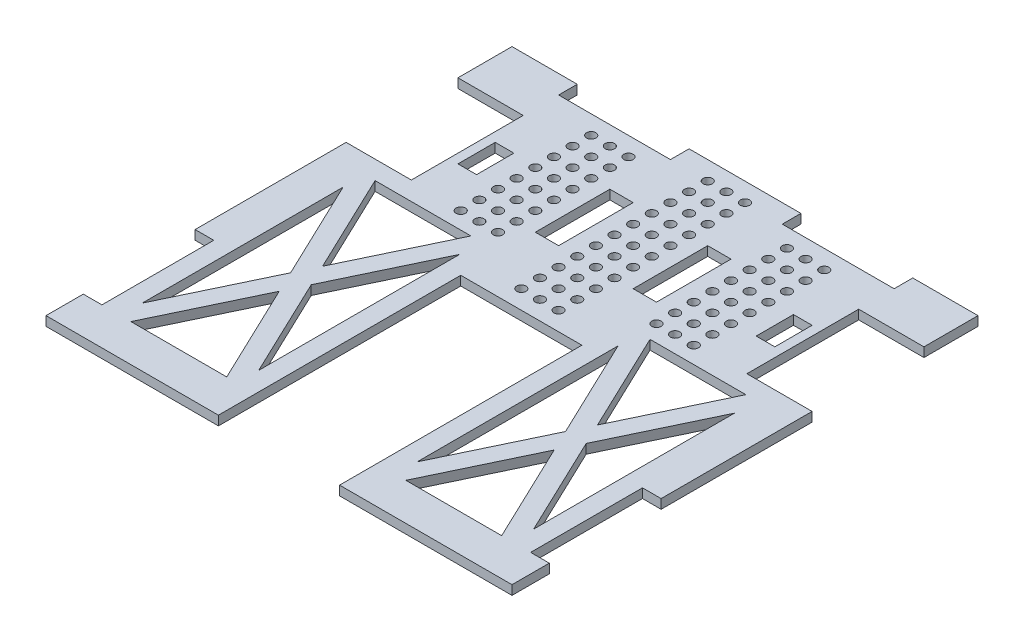
from build123d import *

# Parameters (mm, degrees)
BOSS_EXTRUDE1_DEPTH = 6.35
SKETCH2_W           = 44.45
SKETCH2_H           = 76.2
SKETCH2_W_2         = 12.7
SKETCH2_W_3         = 76.2
SKETCH2_H_2         = 12.7
CUT_EXTRUDE1_DEPTH  = 289.907554418
CUT_EXTRUDE3_DEPTH  = 289.907554418
SKETCH3_W           = 15.875
SKETCH3_H           = 50.8
SKETCH3_W_2         = 12.7
SKETCH3_H_2         = 25.4
CUT_EXTRUDE2_DEPTH  = 289.907554418
SKETCH5_R           = 3.175
CUT_EXTRUDE4_DEPTH  = 289.907554418


with BuildPart() as part:
    # Sketch1 → Boss-Extrude1 (new body)
    with BuildSketch(Plane(origin=(0, 0, 0), x_dir=(1, 0, 0), z_dir=(0, 1, 0))):
        Polygon((-158.75, 76.2), (-158.75, -241.3), (-41.275, -241.3), (-41.275, -76.2), (41.275, -76.2), (41.275, -241.3), (158.75, -241.3), (158.75, 76.2), align=None)
    extrude(amount=BOSS_EXTRUDE1_DEPTH)

    # Sketch2 → Cut-Extrude1 (cut, through all)
    with BuildSketch(Plane(origin=(0, 6.35, 0), x_dir=(1, 0, 0), z_dir=(0, 1, 0))):
        with Locations((136.525, 1.27)):
            Rectangle(SKETCH2_W, SKETCH2_H)
        with Locations((152.4, -177.8)):
            Rectangle(SKETCH2_W_2, SKETCH2_H)
        with Locations((-152.4, -177.8)):
            Rectangle(SKETCH2_W_2, SKETCH2_H)
        with Locations((-136.525, 1.27)):
            Rectangle(SKETCH2_W, SKETCH2_H)
        with Locations((-76.2, 69.85)):
            Rectangle(SKETCH2_W_3, SKETCH2_H_2)
        with Locations((76.2, 69.85)):
            Rectangle(SKETCH2_W_3, SKETCH2_H_2)
    extrude(amount=-CUT_EXTRUDE1_DEPTH, mode=Mode.SUBTRACT)

    # Sketch4 → Cut-Extrude3 (cut, through all)
    with BuildSketch(Plane(origin=(0, 6.35, 0), x_dir=(1, 0, 0), z_dir=(0, 1, 0))):
        Polygon((93.6625, -147.46179464), (61.010684466, -215.9), (126.314315534, -215.9), align=None)
        Polygon((53.975, -64.27679464), (53.975, -201.15320536), (86.626815534, -132.715), align=None)
        Polygon((133.35, -64.27679464), (100.698184466, -132.715), (133.35, -201.15320536), align=None)
        Polygon((61.010684466, -49.53), (93.6625, -117.96820536), (126.314315534, -49.53), align=None)
        Polygon((-86.626815534, -132.715), (-53.975, -201.15320536), (-53.975, -64.27679464), align=None)
        Polygon((-126.314315534, -49.53), (-93.6625, -117.96820536), (-61.010684466, -49.53), align=None)
        Polygon((-61.010684466, -215.9), (-93.6625, -147.46179464), (-126.314315534, -215.9), align=None)
        Polygon((-133.35, -201.15320536), (-100.698184466, -132.715), (-133.35, -64.27679464), align=None)
    extrude(amount=-CUT_EXTRUDE3_DEPTH, mode=Mode.SUBTRACT)

    # Sketch3 → Cut-Extrude2 (cut, through all)
    with BuildSketch(Plane(origin=(0, 6.35, 0), x_dir=(1, 0, 0), z_dir=(0, 1, 0))):
        with Locations((-33.3375, 0)):
            Rectangle(SKETCH3_W, SKETCH3_H)
        with Locations((33.3375, 0)):
            Rectangle(SKETCH3_W, SKETCH3_H)
        with Locations((101.6, 1.27)):
            Rectangle(SKETCH3_W_2, SKETCH3_H_2)
        with Locations((-101.6, 1.27)):
            Rectangle(SKETCH3_W_2, SKETCH3_H_2)
    extrude(amount=-CUT_EXTRUDE2_DEPTH, mode=Mode.SUBTRACT)

    # Sketch5 → Cut-Extrude4 (cut, through all)
    with BuildSketch(Plane(origin=(0, 6.35, 0), x_dir=(1, 0, 0), z_dir=(0, 1, 0))):
        with Locations((12.7, 63.5)):
            Circle(SKETCH5_R)
        with Locations((12.7, 50.8)):
            Circle(SKETCH5_R)
        with Locations((12.7, 38.1)):
            Circle(SKETCH5_R)
        with Locations((12.7, 25.4)):
            Circle(SKETCH5_R)
        with Locations((12.7, 12.7)):
            Circle(SKETCH5_R)
        with Locations((12.7, 0)):
            Circle(SKETCH5_R)
        with Locations((12.7, -12.7)):
            Circle(SKETCH5_R)
        with Locations((12.7, -25.4)):
            Circle(SKETCH5_R)
        with Locations((12.7, -38.1)):
            Circle(SKETCH5_R)
        with Locations((12.7, -50.8)):
            Circle(SKETCH5_R)
        with Locations((12.7, -63.5)):
            Circle(SKETCH5_R)
        with Locations((0, 50.8)):
            Circle(SKETCH5_R)
        with Locations((0, 38.1)):
            Circle(SKETCH5_R)
        with Locations((0, 25.4)):
            Circle(SKETCH5_R)
        with Locations((0, 12.7)):
            Circle(SKETCH5_R)
        Circle(SKETCH5_R)
        with Locations((0, -12.7)):
            Circle(SKETCH5_R)
        with Locations((0, -25.4)):
            Circle(SKETCH5_R)
        with Locations((0, -38.1)):
            Circle(SKETCH5_R)
        with Locations((0, -50.8)):
            Circle(SKETCH5_R)
        with Locations((0, -63.5)):
            Circle(SKETCH5_R)
        with Locations((-12.7, 50.8)):
            Circle(SKETCH5_R)
        with Locations((-12.7, 38.1)):
            Circle(SKETCH5_R)
        with Locations((-12.7, 25.4)):
            Circle(SKETCH5_R)
        with Locations((-12.7, 12.7)):
            Circle(SKETCH5_R)
        with Locations((-12.7, 0)):
            Circle(SKETCH5_R)
        with Locations((-12.7, -12.7)):
            Circle(SKETCH5_R)
        with Locations((-12.7, -25.4)):
            Circle(SKETCH5_R)
        with Locations((-12.7, -38.1)):
            Circle(SKETCH5_R)
        with Locations((-12.7, -50.8)):
            Circle(SKETCH5_R)
        with Locations((-12.7, -63.5)):
            Circle(SKETCH5_R)
        with Locations((0, 63.5)):
            Circle(SKETCH5_R)
        with Locations((-12.7, 63.5)):
            Circle(SKETCH5_R)
        with Locations((53.975, 50.8)):
            Circle(SKETCH5_R)
        with Locations((66.675, 50.8)):
            Circle(SKETCH5_R)
        with Locations((79.375, 50.8)):
            Circle(SKETCH5_R)
        with Locations((66.675, 38.1)):
            Circle(SKETCH5_R)
        with Locations((79.375, 38.1)):
            Circle(SKETCH5_R)
        with Locations((66.675, 25.4)):
            Circle(SKETCH5_R)
        with Locations((79.375, 25.4)):
            Circle(SKETCH5_R)
        with Locations((66.675, 12.7)):
            Circle(SKETCH5_R)
        with Locations((79.375, 12.7)):
            Circle(SKETCH5_R)
        with Locations((66.675, 0)):
            Circle(SKETCH5_R)
        with Locations((79.375, 0)):
            Circle(SKETCH5_R)
        with Locations((66.675, -12.7)):
            Circle(SKETCH5_R)
        with Locations((79.375, -12.7)):
            Circle(SKETCH5_R)
        with Locations((66.675, -25.4)):
            Circle(SKETCH5_R)
        with Locations((79.375, -25.4)):
            Circle(SKETCH5_R)
        with Locations((66.675, -38.1)):
            Circle(SKETCH5_R)
        with Locations((79.375, -38.1)):
            Circle(SKETCH5_R)
        with Locations((53.975, 38.1)):
            Circle(SKETCH5_R)
        with Locations((53.975, 25.4)):
            Circle(SKETCH5_R)
        with Locations((53.975, 12.7)):
            Circle(SKETCH5_R)
        with Locations((53.975, 0)):
            Circle(SKETCH5_R)
        with Locations((53.975, -12.7)):
            Circle(SKETCH5_R)
        with Locations((53.975, -25.4)):
            Circle(SKETCH5_R)
        with Locations((53.975, -38.1)):
            Circle(SKETCH5_R)
        with Locations((-53.975, -38.1)):
            Circle(SKETCH5_R)
        with Locations((-53.975, -25.4)):
            Circle(SKETCH5_R)
        with Locations((-53.975, -12.7)):
            Circle(SKETCH5_R)
        with Locations((-53.975, 0)):
            Circle(SKETCH5_R)
        with Locations((-53.975, 12.7)):
            Circle(SKETCH5_R)
        with Locations((-53.975, 25.4)):
            Circle(SKETCH5_R)
        with Locations((-53.975, 38.1)):
            Circle(SKETCH5_R)
        with Locations((-79.375, -38.1)):
            Circle(SKETCH5_R)
        with Locations((-66.675, -38.1)):
            Circle(SKETCH5_R)
        with Locations((-79.375, -25.4)):
            Circle(SKETCH5_R)
        with Locations((-66.675, -25.4)):
            Circle(SKETCH5_R)
        with Locations((-79.375, -12.7)):
            Circle(SKETCH5_R)
        with Locations((-66.675, -12.7)):
            Circle(SKETCH5_R)
        with Locations((-79.375, 0)):
            Circle(SKETCH5_R)
        with Locations((-66.675, 0)):
            Circle(SKETCH5_R)
        with Locations((-79.375, 12.7)):
            Circle(SKETCH5_R)
        with Locations((-66.675, 12.7)):
            Circle(SKETCH5_R)
        with Locations((-79.375, 25.4)):
            Circle(SKETCH5_R)
        with Locations((-66.675, 25.4)):
            Circle(SKETCH5_R)
        with Locations((-79.375, 38.1)):
            Circle(SKETCH5_R)
        with Locations((-66.675, 38.1)):
            Circle(SKETCH5_R)
        with Locations((-79.375, 50.8)):
            Circle(SKETCH5_R)
        with Locations((-66.675, 50.8)):
            Circle(SKETCH5_R)
        with Locations((-53.975, 50.8)):
            Circle(SKETCH5_R)
    extrude(amount=-CUT_EXTRUDE4_DEPTH, mode=Mode.SUBTRACT)


solid = part.part
